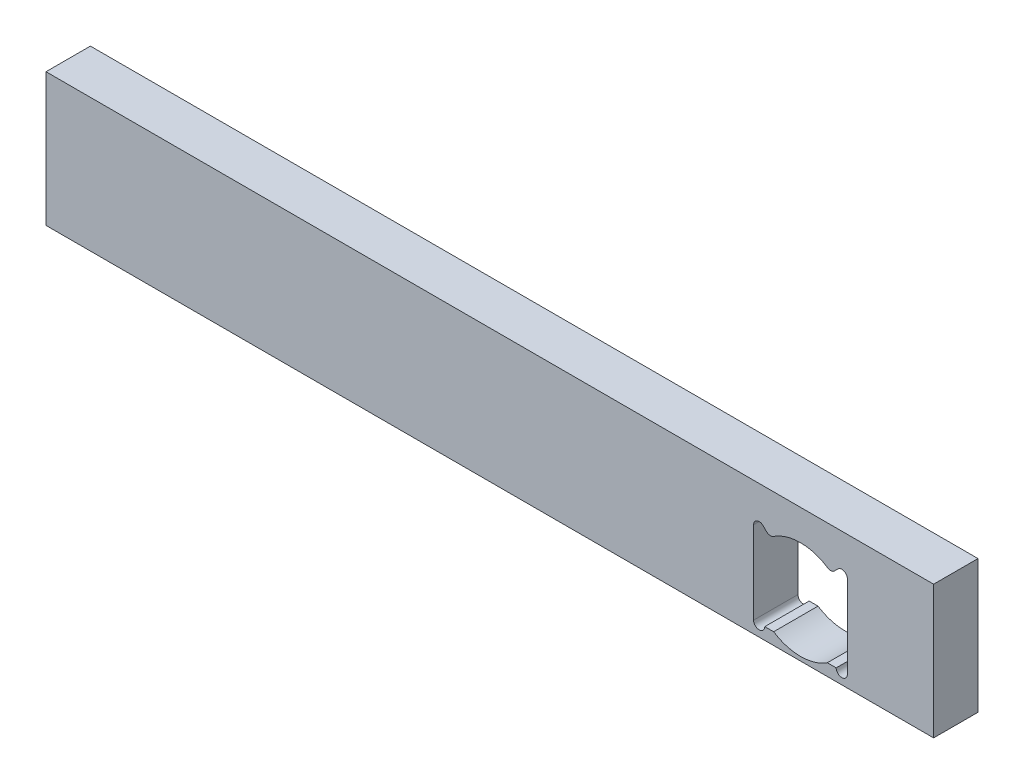
from build123d import *

# Parameters (mm, degrees)
SKETCH1_W           = 254
SKETCH1_H           = 38.1
BOSS_EXTRUDE1_DEPTH = 12.7
CUT_EXTRUDE4_DEPTH  = 218.110576665
FILLET1_R           = 1.5875


with BuildPart() as part:
    # Sketch1 → Boss-Extrude1 (new body)
    with BuildSketch(Plane.XY):
        with Locations((-88.9, 0)):
            Rectangle(SKETCH1_W, SKETCH1_H)
    extrude(amount=BOSS_EXTRUDE1_DEPTH)

    # Sketch5 → Cut-Extrude4 (cut, through all)
    with BuildSketch(Plane.XY.offset(12.7)):
        with BuildLine():
            Line((-8.772142836, 7.225167378), (-10.687223205, 9.140247747))
            ThreePointArc((-10.687223205, 9.140247747), (-12.431105504, 9.487127504), (-13.418935476, 8.008735476))
            Line((-13.418935476, 8.008735476), (-13.418935476, -15.628735476))
            ThreePointArc((-13.418935476, -15.628735476), (-11.818735476, -17.228935476), (-10.218535476, -15.628735476))
            Line((-10.218535476, -15.628735476), (-7.683937842, -15.628735476))
            ThreePointArc((-7.683937842, -15.628735476), (0, -17.907), (7.683937842, -15.628735476))
            Line((7.683937842, -15.628735476), (10.218535476, -15.628735476))
            ThreePointArc((10.218535476, -15.628735476), (11.818735476, -17.228935476), (13.418935476, -15.628735476))
            Line((13.418935476, -15.628735476), (13.418935476, 8.008735476))
            ThreePointArc((13.418935476, 8.008735476), (12.571582801, 9.420776887), (10.926920796, 9.337383893))
            Line((10.926920796, 9.337383893), (8.795831767, 7.206294864))
            ThreePointArc((8.795831767, 7.206294864), (0.015143788, 10.286991866), (-8.772142836, 7.225167378))
        make_face()
    extrude(amount=-CUT_EXTRUDE4_DEPTH, mode=Mode.SUBTRACT)

    # Fillet1
    fillet1_edges = [part.edges().sort_by_distance(p)[0] for p in [
        (8.795831767, 7.206294864, 6.35),
        (-8.772142836, 7.225167378, 6.35),
    ]]
    fillet(fillet1_edges, radius=FILLET1_R)


solid = part.part
